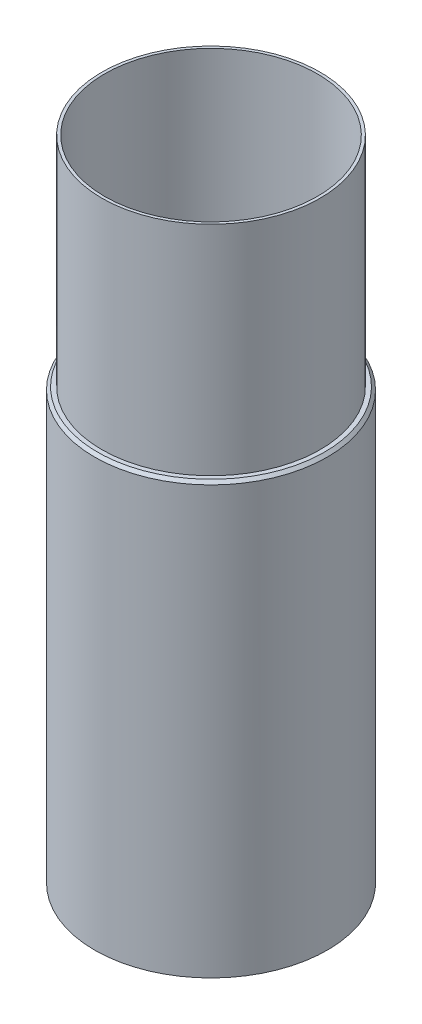
from build123d import *

# Parameters (mm, degrees)
SKETCH1_W                = 5
SKETCH1_H                = 300
BOSS_EXTRUDE1_DEPTH      = 152
BOSS_EXTRUDE1_DEPTH_BACK = 152
SKETCH3_R                = 76.2
SKETCH3_R_2              = 74.2
CHAMFER1_SIZE            = 2


with BuildPart() as part:
    # Sketch1 → Revolve1 (revolve)
    with BuildSketch(Plane.XY):
        with Locations((78.7, 150)):
            Rectangle(SKETCH1_W, SKETCH1_H)
    revolve(axis=Axis((0, 204.615384615, 0), (0, -1, 0)))

    # Sketch3 → Boss-Extrude1 (add, two sides: drawn at the far end of the back side and taken through both)
    with BuildSketch(Plane(origin=(0, 300, 0), x_dir=(1, 0, 0), z_dir=(0, 1, 0)).offset(-BOSS_EXTRUDE1_DEPTH_BACK)):
        Circle(SKETCH3_R)
        Circle(SKETCH3_R_2, mode=Mode.SUBTRACT)
    extrude(amount=BOSS_EXTRUDE1_DEPTH + BOSS_EXTRUDE1_DEPTH_BACK)

    # Chamfer1
    chamfer1_edges = [part.edges().sort_by_distance(p)[0] for p in [
        (-81.2, 300, 0),
    ]]
    chamfer(chamfer1_edges, length=CHAMFER1_SIZE)


solid = part.part
